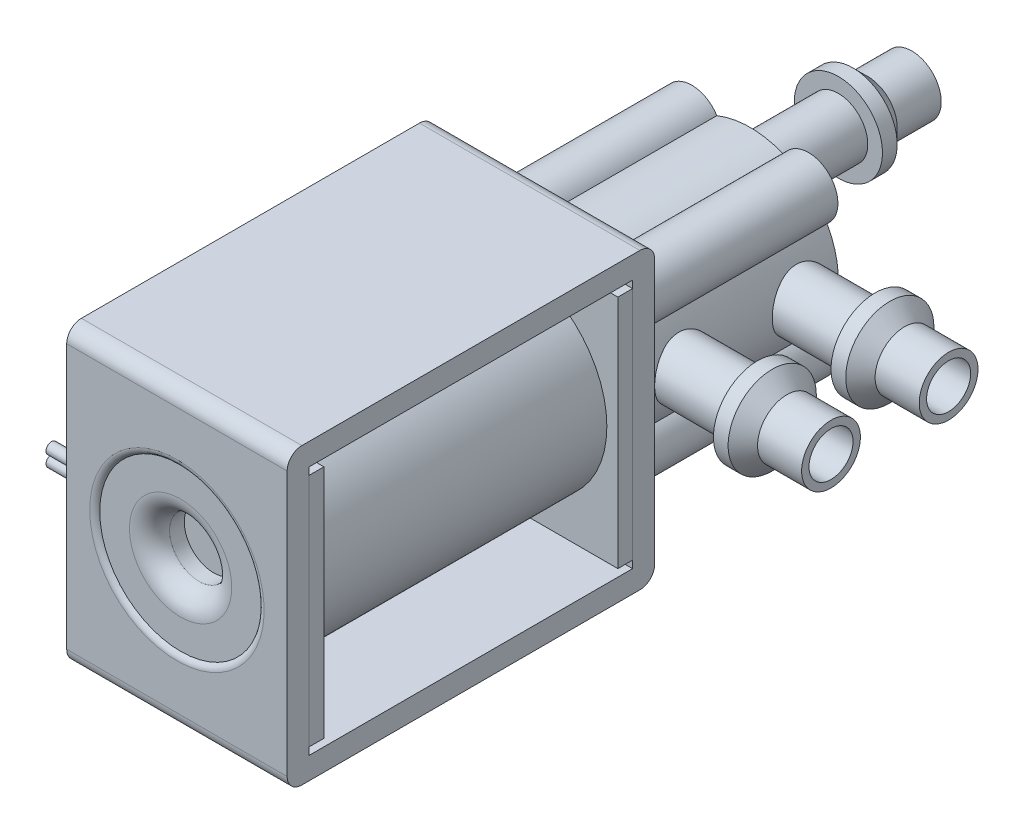
from build123d import *

# Parameters (mm, degrees)
SKETCH1_W                    = 15
SKETCH1_H                    = 20
OUTER_SHELL_DEPTH            = 12.5
SKETCH2_W                    = 22
SKETCH2_H                    = 17
CUT_EXTRUDE1_DEPTH           = 15
SKETCH4_W                    = 15
SKETCH4_H                    = 16
INNER1_DEPTH                 = 1
SKETCH5_W                    = 15
SKETCH5_H                    = 16
INNER2_DEPTH                 = 1
SKETCH6_R                    = 6.75
INNER_CYLINDER_DEPTH         = 20
FILLET1_R                    = 1
SKETCH7_R                    = 5.5
CUT_EXTRUDE2_DEPTH           = 0.25
SKETCH8_R                    = 2
CUT_EXTRUDE3_DEPTH           = 2.25
FILLET2_R                    = 0.5
FILLET3_R                    = 1.5
SKETCH9_R                    = 6
OUTER_CYLINDER_DEPTH         = 14
SKETCH10_R                   = 2
CIRCLE_CUTS_DEPTH            = 28.950849719
SKETCH11_R                   = 2
SMALL_CYLINDERS_DEPTH        = 14
SMALL_CYLINDERS_2_DEPTH      = 14
SMALL_CYLINDERS_3_DEPTH      = 14
SMALL_CYLINDERS_4_DEPTH      = 14
SKETCH12_R                   = 1.5
CUT_EXTRUDE6_DEPTH           = 11.5
BOSS_EXTRUDE9_DEPTH          = 14
SKETCH15_R                   = 2
HORIZONTAL_CYLINDERS_DEPTH   = 11
HORIZONTAL_CYLINDERS_2_DEPTH = 11
SKETCH16_R                   = 1.5
CUT_EXTRUDE7_DEPTH           = 11
SKETCH17_R                   = 3
BOSS_EXTRUDE11_DEPTH         = 2
BOSS_EXTRUDE11_2_DEPTH       = 2
SKETCH19_R                   = 2
BOSS_EXTRUDE12_DEPTH         = 3
BOSS_EXTRUDE12_2_DEPTH       = 3
CHAMFER2_SIZE                = 1
CHAMFER3_SIZE                = 1
SKETCH20_R                   = 1.5
CUT_EXTRUDE8_DEPTH           = 7
SKETCH21_R                   = 2
BOSS_EXTRUDE13_DEPTH         = 6
SKETCH22_R                   = 3
BOSS_EXTRUDE14_DEPTH         = 2
SKETCH23_R                   = 2
BOSS_EXTRUDE15_DEPTH         = 3
CHAMFER4_SIZE                = 1
SKETCH24_R                   = 1.5
CUT_EXTRUDE9_DEPTH           = 11
SKETCH25_R                   = 0.375
BOSS_EXTRUDE17_DEPTH         = 3
BOSS_EXTRUDE17_2_DEPTH       = 3


# Some blends are built 0.0001 mm under size
with BuildPart() as part:
    # Sketch1 → Outer Shell (new, symmetric)
    with BuildSketch(Plane.XY):
        Rectangle(SKETCH1_W, SKETCH1_H)
    extrude(amount=OUTER_SHELL_DEPTH, both=True)

    # Sketch2 → Cut-Extrude1 (cut)
    with BuildSketch(Plane(origin=(7.5, 0, 0), x_dir=(0, 0, -1), z_dir=(1, 0, 0))):
        Rectangle(SKETCH2_W, SKETCH2_H)
    extrude(amount=-CUT_EXTRUDE1_DEPTH, mode=Mode.SUBTRACT)

    # Fillet1
    fillet1_edges = [part.edges().sort_by_distance(p)[0] for p in [
        (0, -10, 12.5),
        (0, -10, -12.5),
        (0, 10, -12.5),
        (0, 10, 12.5),
    ]]
    fillet(fillet1_edges, radius=FILLET1_R)

    # Sketch7 → Cut-Extrude2 (cut)
    with BuildSketch(Plane.XY.offset(12.5)):
        Circle(SKETCH7_R)
    extrude(amount=-CUT_EXTRUDE2_DEPTH, mode=Mode.SUBTRACT)


with BuildPart() as body_2:
    # Sketch4 → Inner1 (new body)
    with BuildSketch(Plane(origin=(0, 0, 11), x_dir=(-1, 0, 0), z_dir=(0, 0, -1))):
        Rectangle(SKETCH4_W, SKETCH4_H)
    extrude(amount=INNER1_DEPTH)


with BuildPart() as body_3:
    # Sketch5 → Inner2 (new body)
    with BuildSketch(Plane.XY.offset(-11)):
        Rectangle(SKETCH5_W, SKETCH5_H)
    extrude(amount=INNER2_DEPTH)


with BuildPart() as body_4:
    # Sketch6 → Inner Cylinder (new body)
    with BuildSketch(Plane.XY.offset(-10)):
        Circle(SKETCH6_R)
    extrude(amount=INNER_CYLINDER_DEPTH)


with BuildPart() as cut_extrude3_tool:
    # Sketch8 → Cut-Extrude3 (new body)
    with BuildSketch(Plane.XY.offset(12.25)):
        Circle(SKETCH8_R)
    extrude(amount=-CUT_EXTRUDE3_DEPTH)


with BuildPart() as part_1:
    add(part.part)

    # Cut-Extrude3: cut by cut_extrude3_tool
    add(cut_extrude3_tool.part, mode=Mode.SUBTRACT)

    # Fillet2
    # the kernel refuses this fillet: 0.5 mm, written as the material it takes off along each edge
    with BuildSketch(Plane(origin=(0, 0, 12.5), x_dir=(1, 0, 0), z_dir=(0, -1, 0))) as fillet2_piece_1:
        with BuildLine():
            CenterArc((5.933012702, -0.5), FILLET2_R, 90, 60)
            Line((5.5, -0.25), (5.491339746, -0.245))
            ThreePointArc((5.491339746, -0.245), (5.49, -0.125), (5.49, 0))
            Line((5.49, 0), (5.5, 0.01))
            Line((5.5, 0.01), (5.933012702, 0.01))
            Line((5.933012702, 0.01), (5.933012702, 0))
        make_face()
    revolve(axis=Axis((0, 0, 12.5), (0, 0, 1)), mode=Mode.SUBTRACT)

    # Fillet3
    # the kernel refuses this fillet: 1.5 mm, written as the material it takes off along each edge
    with BuildSketch(Plane(origin=(0, 0, 12.25), x_dir=(1, 0, 0), z_dir=(0, -1, 0))) as fillet3_piece_1:
        with BuildLine():
            CenterArc((3.479019946, -1.5), FILLET3_R, 90, 80.405931773)
            Line((3.479019946, 0), (3.479019946, 0.03))
            Line((3.479019946, 0.03), (2, 0.03))
            Line((2, 0.03), (1.97, 0))
            ThreePointArc((1.97, 0), (1.97, -0.625), (1.970419601, -1.245))
            Line((1.970419601, -1.245), (2, -1.25))
        make_face()
    revolve(axis=Axis((0, 0, 12.25), (0, 0, 1)), mode=Mode.SUBTRACT)



with BuildPart() as body_2_1:
    add(body_2.part)

    # Cut-Extrude3: cut by cut_extrude3_tool
    add(cut_extrude3_tool.part, mode=Mode.SUBTRACT)


with BuildPart() as body_5:
    # Sketch9 → outer cylinder (new body)
    with BuildSketch(Plane(origin=(0, 0, -12.5), x_dir=(-1, 0, 0), z_dir=(0, 0, -1))):
        Circle(SKETCH9_R)
    extrude(amount=OUTER_CYLINDER_DEPTH)

    # Sketch10 → circle cuts (cut, through all)
    with BuildSketch(Plane(origin=(0, 0, -12.5), x_dir=(-1, 0, 0), z_dir=(0, 0, -1))):
        with Locations((-3.968626967, -4.5)):
            Circle(SKETCH10_R)
        with Locations((3.968626967, -4.5)):
            Circle(SKETCH10_R)
        with Locations((3.968626967, 4.5)):
            Circle(SKETCH10_R)
        with Locations((-3.968626967, 4.5)):
            Circle(SKETCH10_R)
    extrude(amount=CIRCLE_CUTS_DEPTH, mode=Mode.SUBTRACT)


with BuildPart() as body_6:
    # Sketch11 → small cylinders (new body)
    with BuildSketch(Plane(origin=(0, 0, -12.5), x_dir=(-1, 0, 0), z_dir=(0, 0, -1))):
        with Locations((-3.968626967, 4.5)):
            Circle(SKETCH11_R)
    extrude(amount=SMALL_CYLINDERS_DEPTH)


with BuildPart() as body_7:
    # Sketch11 → small cylinders 2 (new body)
    with BuildSketch(Plane(origin=(0, 0, -12.5), x_dir=(-1, 0, 0), z_dir=(0, 0, -1))):
        with Locations((3.968626967, 4.5)):
            Circle(SKETCH11_R)
    extrude(amount=SMALL_CYLINDERS_2_DEPTH)


with BuildPart() as body_8:
    # Sketch11 → small cylinders 3 (new body)
    with BuildSketch(Plane(origin=(0, 0, -12.5), x_dir=(-1, 0, 0), z_dir=(0, 0, -1))):
        with Locations((-3.968626967, -4.5)):
            Circle(SKETCH11_R)
    extrude(amount=SMALL_CYLINDERS_3_DEPTH)


with BuildPart() as body_9:
    # Sketch11 → small cylinders 4 (new body)
    with BuildSketch(Plane(origin=(0, 0, -12.5), x_dir=(-1, 0, 0), z_dir=(0, 0, -1))):
        with Locations((3.968626967, -4.5)):
            Circle(SKETCH11_R)
    extrude(amount=SMALL_CYLINDERS_4_DEPTH)


with BuildPart() as cut_extrude6_tool:
    # Sketch12 → Cut-Extrude6 (new body)
    with BuildSketch(Plane(origin=(0, 0, -26.5), x_dir=(-1, 0, 0), z_dir=(0, 0, -1))):
        with Locations((-3.968626967, 4.5)):
            Circle(SKETCH12_R)
        with Locations((3.968626967, 4.5)):
            Circle(SKETCH12_R)
        with Locations((-3.968626967, -4.5)):
            Circle(SKETCH12_R)
        with Locations((3.968626967, -4.5)):
            Circle(SKETCH12_R)
    extrude(amount=-CUT_EXTRUDE6_DEPTH)


with BuildPart() as body_6_1:
    add(body_6.part)

    # Cut-Extrude6: cut by cut_extrude6_tool
    add(cut_extrude6_tool.part, mode=Mode.SUBTRACT)


with BuildPart() as body_7_1:
    add(body_7.part)

    # Cut-Extrude6: cut by cut_extrude6_tool
    add(cut_extrude6_tool.part, mode=Mode.SUBTRACT)


with BuildPart() as body_8_1:
    add(body_8.part)

    # Cut-Extrude6: cut by cut_extrude6_tool
    add(cut_extrude6_tool.part, mode=Mode.SUBTRACT)


with BuildPart() as body_9_1:
    add(body_9.part)

    # Cut-Extrude6: cut by cut_extrude6_tool
    add(cut_extrude6_tool.part, mode=Mode.SUBTRACT)


with BuildPart() as part_2:
    add(part_1.part)

    add(body_5.part)  # Boss-Extrude9 merges body 5

    add(body_7_1.part)  # Boss-Extrude9 merges body 7

    add(body_9_1.part)  # Boss-Extrude9 merges body 9
    # Sketch14 → Boss-Extrude9 (add)
    with BuildSketch(Plane(origin=(0, 0, -12.5), x_dir=(-1, 0, 0), z_dir=(0, 0, -1))):
        Polygon((5.227167636, 2.945627013), (5.227167636, -2.945627013), (4.923679057, -2.700868739), (4.923679057, 2.642138434), align=None)
    extrude(amount=BOSS_EXTRUDE9_DEPTH)


with BuildPart() as body_7_2:
    # Sketch15 → horizontal cylinders (new body)
    with BuildSketch(Plane(origin=(0, 0, 0), x_dir=(0, 0, -1), z_dir=(1, 0, 0))):
        with Locations((16, 0)):
            Circle(SKETCH15_R)
    extrude(amount=HORIZONTAL_CYLINDERS_DEPTH)


with BuildPart() as body_8_2:
    # Sketch15 → horizontal cylinders 2 (new body)
    with BuildSketch(Plane(origin=(0, 0, 0), x_dir=(0, 0, -1), z_dir=(1, 0, 0))):
        with Locations((24, 0)):
            Circle(SKETCH15_R)
    extrude(amount=HORIZONTAL_CYLINDERS_2_DEPTH)


with BuildPart() as cut_extrude7_tool:
    # Sketch16 → Cut-Extrude7 (new body)
    with BuildSketch(Plane(origin=(11, 0, 0), x_dir=(0, 0, -1), z_dir=(1, 0, 0))):
        with Locations((16, 0)):
            Circle(SKETCH16_R)
        with Locations((24, 0)):
            Circle(SKETCH16_R)
    extrude(amount=-CUT_EXTRUDE7_DEPTH)


with BuildPart() as part_3:
    add(part_2.part)

    # Cut-Extrude7: cut by cut_extrude7_tool
    add(cut_extrude7_tool.part, mode=Mode.SUBTRACT)


with BuildPart() as body_7_2_1:
    add(body_7_2.part)

    # Cut-Extrude7: cut by cut_extrude7_tool
    add(cut_extrude7_tool.part, mode=Mode.SUBTRACT)


with BuildPart() as body_8_2_1:
    add(body_8_2.part)

    # Cut-Extrude7: cut by cut_extrude7_tool
    add(cut_extrude7_tool.part, mode=Mode.SUBTRACT)


with BuildPart() as body_9_2:
    # Sketch17 → Boss-Extrude11 (new body)
    with BuildSketch(Plane(origin=(11, 0, 0), x_dir=(0, 0, -1), z_dir=(1, 0, 0))):
        with Locations((16, 0)):
            Circle(SKETCH17_R)
    extrude(amount=BOSS_EXTRUDE11_DEPTH)

    # Chamfer3
    chamfer3_edges = [body_9_2.edges().sort_by_distance(p)[0] for p in [
        (13, 0, -13),
    ]]
    chamfer(chamfer3_edges, length=CHAMFER3_SIZE)


with BuildPart() as body_10:
    # Sketch17 → Boss-Extrude11 2 (new body)
    with BuildSketch(Plane(origin=(11, 0, 0), x_dir=(0, 0, -1), z_dir=(1, 0, 0))):
        with Locations((24, 0)):
            Circle(SKETCH17_R)
    extrude(amount=BOSS_EXTRUDE11_2_DEPTH)

    # Chamfer2
    chamfer2_edges = [body_10.edges().sort_by_distance(p)[0] for p in [
        (13, 0, -21),
    ]]
    chamfer(chamfer2_edges, length=CHAMFER2_SIZE)


with BuildPart() as body_11:
    # Sketch19 → Boss-Extrude12 (new body)
    with BuildSketch(Plane(origin=(13, 0, 0), x_dir=(0, 0, -1), z_dir=(1, 0, 0))):
        with Locations((16, 0)):
            Circle(SKETCH19_R)
    extrude(amount=BOSS_EXTRUDE12_DEPTH)


with BuildPart() as body_12:
    # Sketch19 → Boss-Extrude12 2 (new body)
    with BuildSketch(Plane(origin=(13, 0, 0), x_dir=(0, 0, -1), z_dir=(1, 0, 0))):
        with Locations((24, 0)):
            Circle(SKETCH19_R)
    extrude(amount=BOSS_EXTRUDE12_2_DEPTH)


with BuildPart() as cut_extrude8_tool:
    # Sketch20 → Cut-Extrude8 (new body)
    with BuildSketch(Plane(origin=(16, 0, 0), x_dir=(0, 0, -1), z_dir=(1, 0, 0))):
        with Locations((16, 0)):
            Circle(SKETCH20_R)
        with Locations((24, 0)):
            Circle(SKETCH20_R)
    extrude(amount=-CUT_EXTRUDE8_DEPTH)


with BuildPart() as body_9_2_1:
    add(body_9_2.part)

    # Cut-Extrude8: cut by cut_extrude8_tool
    add(cut_extrude8_tool.part, mode=Mode.SUBTRACT)


with BuildPart() as body_10_1:
    add(body_10.part)

    # Cut-Extrude8: cut by cut_extrude8_tool
    add(cut_extrude8_tool.part, mode=Mode.SUBTRACT)


with BuildPart() as body_11_1:
    add(body_11.part)

    # Cut-Extrude8: cut by cut_extrude8_tool
    add(cut_extrude8_tool.part, mode=Mode.SUBTRACT)


with BuildPart() as body_12_1:
    add(body_12.part)

    # Cut-Extrude8: cut by cut_extrude8_tool
    add(cut_extrude8_tool.part, mode=Mode.SUBTRACT)


with BuildPart() as body_13:
    # Sketch21 → Boss-Extrude13 (new body)
    with BuildSketch(Plane(origin=(0, 0, -26.5), x_dir=(-1, 0, 0), z_dir=(0, 0, -1))):
        with Locations((0, 3)):
            Circle(SKETCH21_R)
    extrude(amount=BOSS_EXTRUDE13_DEPTH)


with BuildPart() as body_14:
    # Sketch22 → Boss-Extrude14 (new body)
    with BuildSketch(Plane(origin=(0, 0, -32.5), x_dir=(-1, 0, 0), z_dir=(0, 0, -1))):
        with Locations((0, 3)):
            Circle(SKETCH22_R)
    extrude(amount=BOSS_EXTRUDE14_DEPTH)

    # Sketch23 → Boss-Extrude15 (add)
    with BuildSketch(Plane(origin=(0, 0, -34.5), x_dir=(-1, 0, 0), z_dir=(0, 0, -1))):
        with Locations((0, 3)):
            Circle(SKETCH23_R)
    extrude(amount=BOSS_EXTRUDE15_DEPTH)

    # Chamfer4
    chamfer4_edges = [body_14.edges().sort_by_distance(p)[0] for p in [
        (3, 3, -34.5),
    ]]
    chamfer(chamfer4_edges, length=CHAMFER4_SIZE - 0.0001)  # a hair under: the kernel refuses the full size


with BuildPart() as cut_extrude9_tool:
    # Sketch24 → Cut-Extrude9 (new body)
    with BuildSketch(Plane(origin=(0, 0, -37.5), x_dir=(-1, 0, 0), z_dir=(0, 0, -1))):
        with Locations((0, 3)):
            Circle(SKETCH24_R)
    extrude(amount=-CUT_EXTRUDE9_DEPTH)


with BuildPart() as body_13_1:
    add(body_13.part)

    # Cut-Extrude9: cut by cut_extrude9_tool
    add(cut_extrude9_tool.part, mode=Mode.SUBTRACT)


with BuildPart() as body_14_1:
    add(body_14.part)

    # Cut-Extrude9: cut by cut_extrude9_tool
    add(cut_extrude9_tool.part, mode=Mode.SUBTRACT)


with BuildPart() as body_15:
    # Sketch25 → Boss-Extrude17 (new body)
    with BuildSketch(Plane.ZY.offset(7.5)):
        with Locations((10.533115749, 0.38)):
            Circle(SKETCH25_R)
    extrude(amount=BOSS_EXTRUDE17_DEPTH)


with BuildPart() as body_16:
    # Sketch25 → Boss-Extrude17 2 (new body)
    with BuildSketch(Plane.ZY.offset(7.5)):
        with Locations((10.533115749, -0.38)):
            Circle(SKETCH25_R)
    extrude(amount=BOSS_EXTRUDE17_2_DEPTH)


solid = Compound([body_3.part, body_4.part, body_2_1.part, body_6_1.part, body_8_1.part, part_3.part, body_7_2_1.part, body_8_2_1.part, body_9_2_1.part, body_10_1.part, body_11_1.part, body_12_1.part, body_13_1.part, body_14_1.part, body_15.part, body_16.part])
